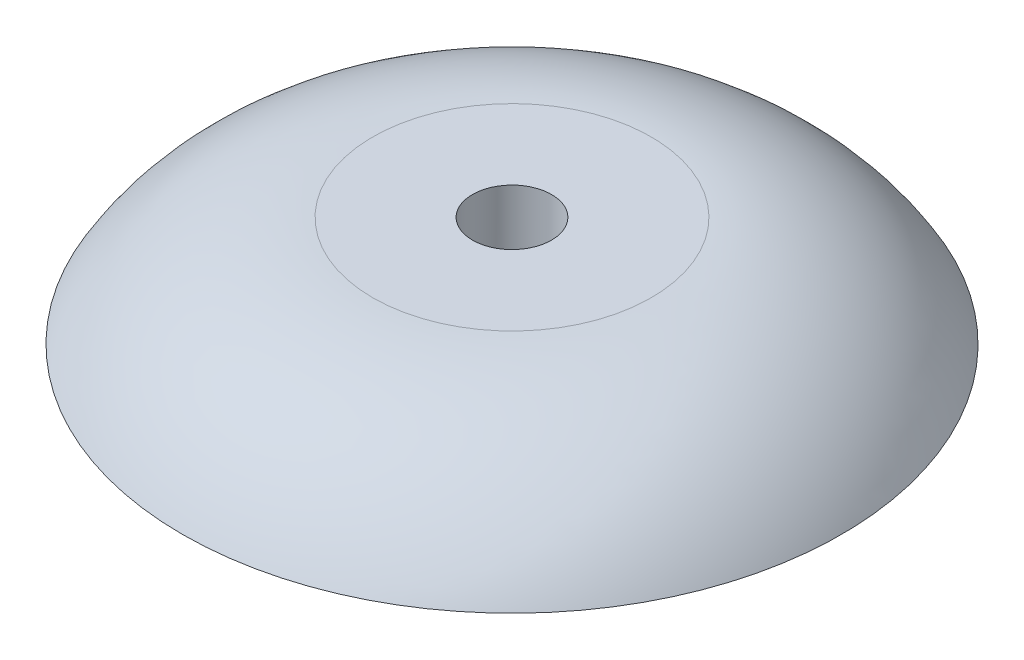
from build123d import *

# Parameters (mm, degrees)
SKETCH2_R            = 15
BOSS_EXTRUDE1_DEPTH  = 5
SKETCH3_R            = 10
CUT_EXTRUDE1_DEPTH   = 2
M3_CLEARANCE_HOLE1_D = 3.6
FILLET1_R            = 10


with BuildPart() as part:
    # Sketch2 → Boss-Extrude1 (new body)
    with BuildSketch(Plane(origin=(0, 0, 0), x_dir=(1, 0, 0), z_dir=(0, 1, 0))):
        with Locations(Location((0, 0, 0), (0, 0, 270))):
            Circle(SKETCH2_R)
    extrude(amount=BOSS_EXTRUDE1_DEPTH)

    # Sketch3 → Cut-Extrude1 (cut)
    with BuildSketch(Plane.XZ):
        with Locations(Location((0, 0, 0), (0, 0, 270))):
            Circle(SKETCH3_R)
    extrude(amount=-CUT_EXTRUDE1_DEPTH, mode=Mode.SUBTRACT)

    # M3 Clearance Hole1 (through all)
    with Locations(Plane(origin=(0, 5, 0), x_dir=(1, 0, 0), z_dir=(0, 1, 0))):
        with Locations((0, 0)):
            Hole(M3_CLEARANCE_HOLE1_D / 2)

    # Fillet1
    # the kernel refuses this fillet: 10 mm, written as the material it takes off along each edge
    with BuildSketch(Plane(origin=(0, 5, 0), x_dir=(0, 0, 1), z_dir=(-1, 0, 0))) as fillet1_piece_1:
        with BuildLine():
            CenterArc((6.339745962, -10), FILLET1_R, 30, 60)
            Line((6.339745962, 0), (6.339745962, 0.2))
            Line((6.339745962, 0.2), (15, 0.2))
            Line((15, 0.2), (15.2, 0))
            ThreePointArc((15.2, 0), (15.2, -2.5), (15.173205081, -4.9))
            Line((15.173205081, -4.9), (15, -5))
        make_face()
    revolve(axis=Axis((0, 5, 0), (0, 1, 0)), mode=Mode.SUBTRACT)


solid = part.part
